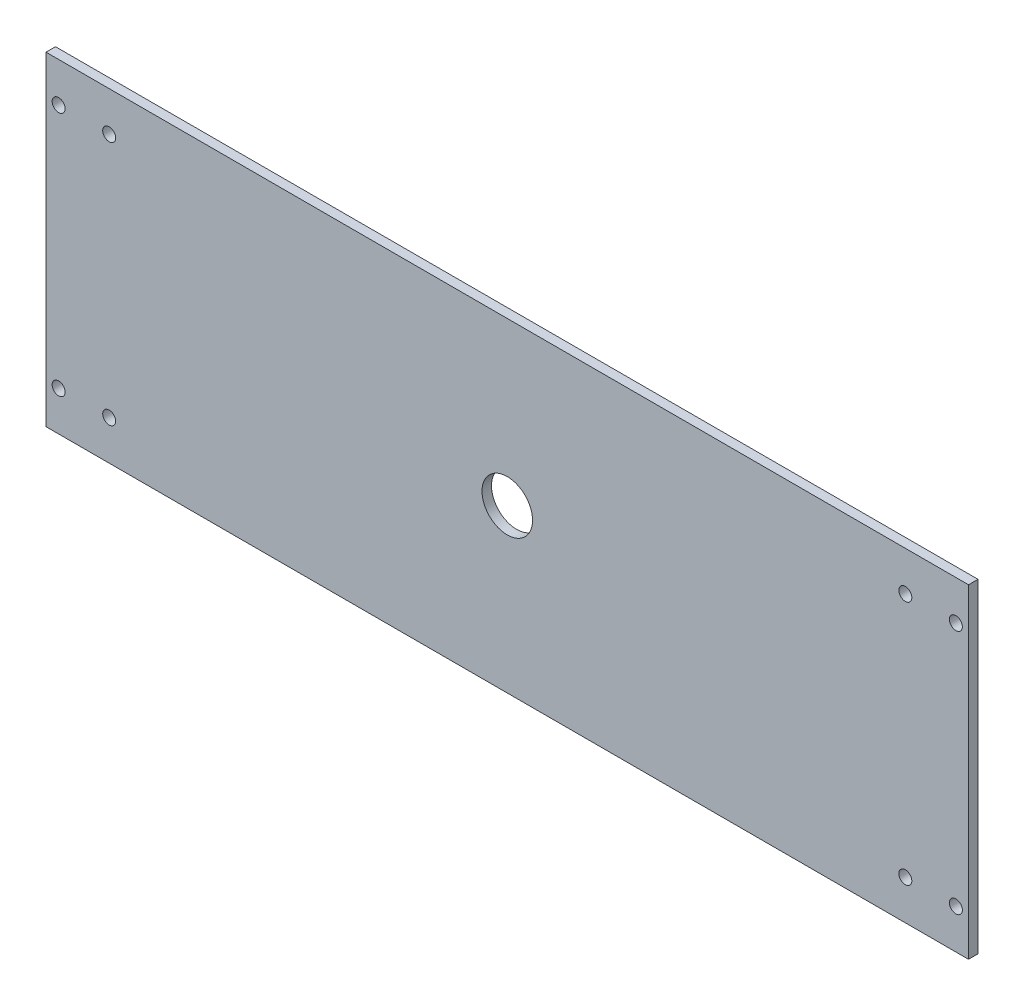
from build123d import *

# Parameters (mm, degrees)
SKETCH1_W                  = 231.775
SKETCH1_H                  = 81.4959
BOSS_EXTRUDE1_DEPTH        = 2.38125
F_4_CLEARANCE_HOLE2_D      = 3.2639
MIRROR3_COPY_1_D           = 3.2639
MIRROR3_COPY_2_D           = 3.2639
F_1_2_0_5_DIAMETER_HOLE1_D = 12.7


with BuildPart() as part:
    # Sketch1 → Boss-Extrude1 (new body)
    with BuildSketch(Plane.XY):
        Rectangle(SKETCH1_W, SKETCH1_H)
    extrude(amount=BOSS_EXTRUDE1_DEPTH)

    # #4 Clearance Hole2 (through all)
    with Locations(Plane.XY.offset(2.38125)):
        with Locations((-112.7125, 30.82036), (-100.0125, 30.82036)):
            f_4_clearance_hole2 = Hole(F_4_CLEARANCE_HOLE2_D / 2)

    # Mirror2: #4 Clearance Hole2 across plane
    add(f_4_clearance_hole2.mirror(Plane(origin=(0, 0, 0), x_dir=(0, 0, 1), z_dir=(1, 0, 0))), mode=Mode.SUBTRACT)

    # Mirror3 copy 1 (through all)
    with Locations(Plane(origin=(0, 0, 2.38125), x_dir=(-1, 0, 0), z_dir=(0, 0, 1))):
        with Locations((-112.7125, 30.82036), (-100.0125, 30.82036)):
            Hole(MIRROR3_COPY_1_D / 2)

    # Mirror3 copy 2 (through all)
    with Locations(Plane.XY.offset(2.38125)):
        with Locations((-112.7125, -30.82036), (-100.0125, -30.82036)):
            Hole(MIRROR3_COPY_2_D / 2)

    # 1/2 (0.5) Diameter Hole1 (through all)
    with Locations(Plane.XY.offset(2.38125)):
        with Locations((0, 0)):
            Hole(F_1_2_0_5_DIAMETER_HOLE1_D / 2)


solid = part.part
